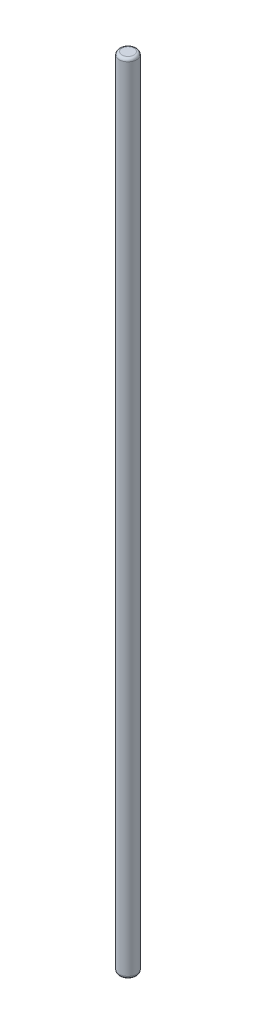
from build123d import *

# Parameters (mm, degrees)
SKETCH1_R           = 0.95
BOSS_EXTRUDE1_DEPTH = 87
FILLET1_R           = 0.3


with BuildPart() as part:
    # Sketch1 → Boss-Extrude1 (new body)
    with BuildSketch(Plane(origin=(0, 0, 0), x_dir=(1, 0, 0), z_dir=(0, 1, 0))):
        Circle(SKETCH1_R)
    extrude(amount=BOSS_EXTRUDE1_DEPTH)

    # Fillet1
    fillet1_edges = [part.edges().sort_by_distance(p)[0] for p in [
        (-0.95, 0, 0),
        (-0.95, 87, 0),
    ]]
    fillet(fillet1_edges, radius=FILLET1_R)


solid = part.part
